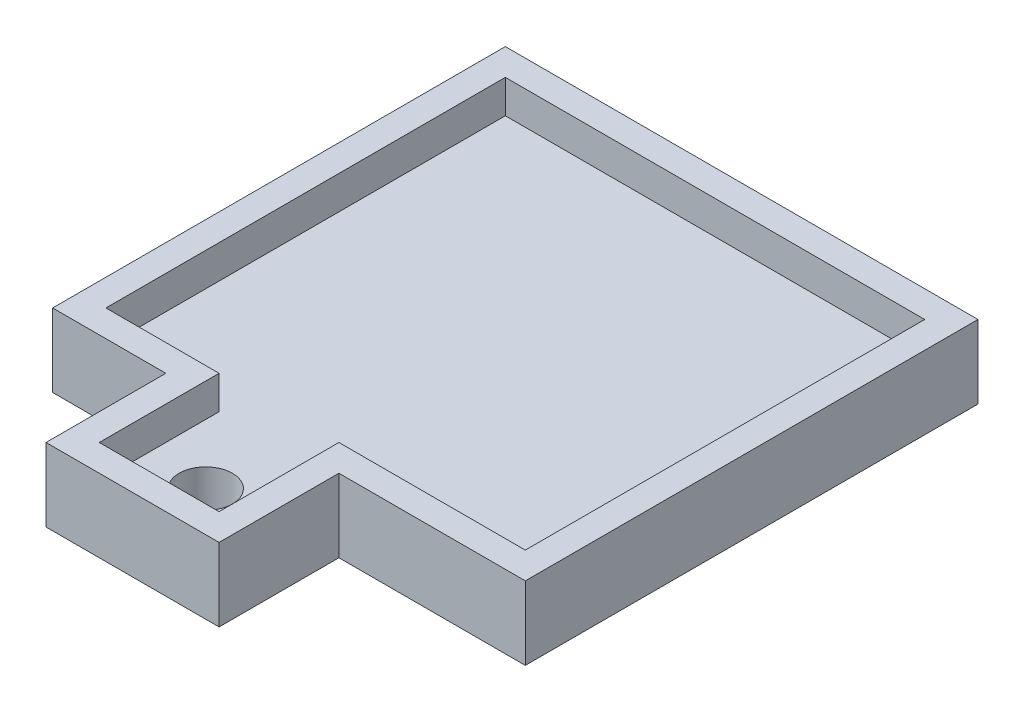
from build123d import *

# Parameters (mm, degrees)
SKETCH1_R           = 20
BOSS_EXTRUDE1_DEPTH = 30
SCALE1_SCALE        = 0.1
BOSS_EXTRUDE2_DEPTH = 5.5


with BuildPart() as part:
    # Sketch1 → Boss-Extrude1 (new body)
    with BuildSketch(Plane(origin=(0, 0, 0), x_dir=(1, 0, 0), z_dir=(0, 1, 0))):
        Polygon((157.5, 300), (-157.5, 300), (-157.5, 0), (-72.5, 0), (-72.5, -90), (17.5, -90), (17.5, 0), (157.5, 0), align=None)
        with Locations((-27.5, -55)):
            Circle(SKETCH1_R, mode=Mode.SUBTRACT)
    extrude(amount=BOSS_EXTRUDE1_DEPTH)


with BuildPart() as part_1:
    # Scale1: scaled about (-1.856978843, 15, -136.956329807)
    add(part.part.scale(SCALE1_SCALE).moved(Location((-1.671280959, 13.5, -123.260696826))))

    # Sketch2 → Boss-Extrude2 (add)
    with BuildSketch(Plane.XZ.offset(-13.5)):
        Polygon((-19.421280958, -155.260696826), (-19.421280958, -121.260696826), (-10.921280958, -121.260696826), (-10.921280958, -112.260696826), (2.078719042, -112.260696826), (2.078719042, -121.260696826), (16.078719042, -121.260696826), (16.078719042, -155.260696826), align=None)
        Polygon((14.078719042, -153.260696826), (14.078719042, -123.260696826), (0.078719042, -123.260696826), (0.078719042, -114.260696826), (-8.921280958, -114.260696826), (-8.921280958, -123.260696826), (-17.421280958, -123.260696826), (-17.421280958, -153.260696826), align=None, mode=Mode.SUBTRACT)
    extrude(amount=-BOSS_EXTRUDE2_DEPTH)


solid = part_1.part
